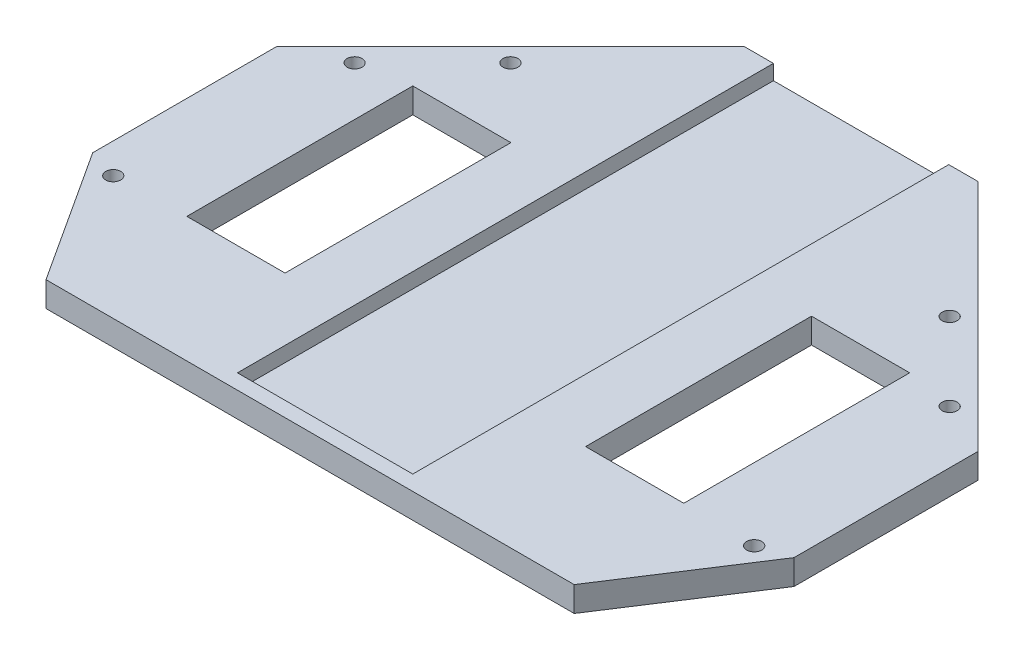
from build123d import *

# Parameters (mm, degrees)
SKETCH1_R           = 1.5
SKETCH1_W           = 19.6
SKETCH1_H           = 45.1
BOSS_EXTRUDE1_DEPTH = 5
SKETCH2_W           = 35
SKETCH2_H           = 107
CUT_EXTRUDE1_DEPTH  = 3


with BuildPart() as part:
    # Sketch1 → Boss-Extrude1 (new body)
    with BuildSketch(Plane(origin=(0, 0, 0), x_dir=(1, 0, 0), z_dir=(0, 1, 0))):
        Polygon((-52.719673599, -40), (-70, -13.390630812), (-70, 23.338095117), (-23.338095117, 70), (0, 70), (0, -40), align=None)
        with Locations((-43.840620434, 43.840620434)):
            Circle(SKETCH1_R, mode=Mode.SUBTRACT)
        with Locations((-59.39696962, 28.284271247)):
            Circle(SKETCH1_R, mode=Mode.SUBTRACT)
        with Locations((-63.979633983, -15.316867676)):
            Circle(SKETCH1_R, mode=Mode.SUBTRACT)
        with Locations((-39.8, 7.55)):
            Rectangle(SKETCH1_W, SKETCH1_H, mode=Mode.SUBTRACT)
    boss_extrude1 = extrude(amount=BOSS_EXTRUDE1_DEPTH)

    # Mirror1: Boss-Extrude1 across plane
    add(boss_extrude1.mirror(Plane(origin=(0, 5, 40), x_dir=(0, 0, 1), z_dir=(-1, 0, 0))))

    # Sketch2 → Cut-Extrude1 (cut)
    with BuildSketch(Plane(origin=(0, 5, 0), x_dir=(1, 0, 0), z_dir=(0, 1, 0))):
        with Locations((0, 16.5)):
            Rectangle(SKETCH2_W, SKETCH2_H)
    extrude(amount=-CUT_EXTRUDE1_DEPTH, mode=Mode.SUBTRACT)


solid = part.part
